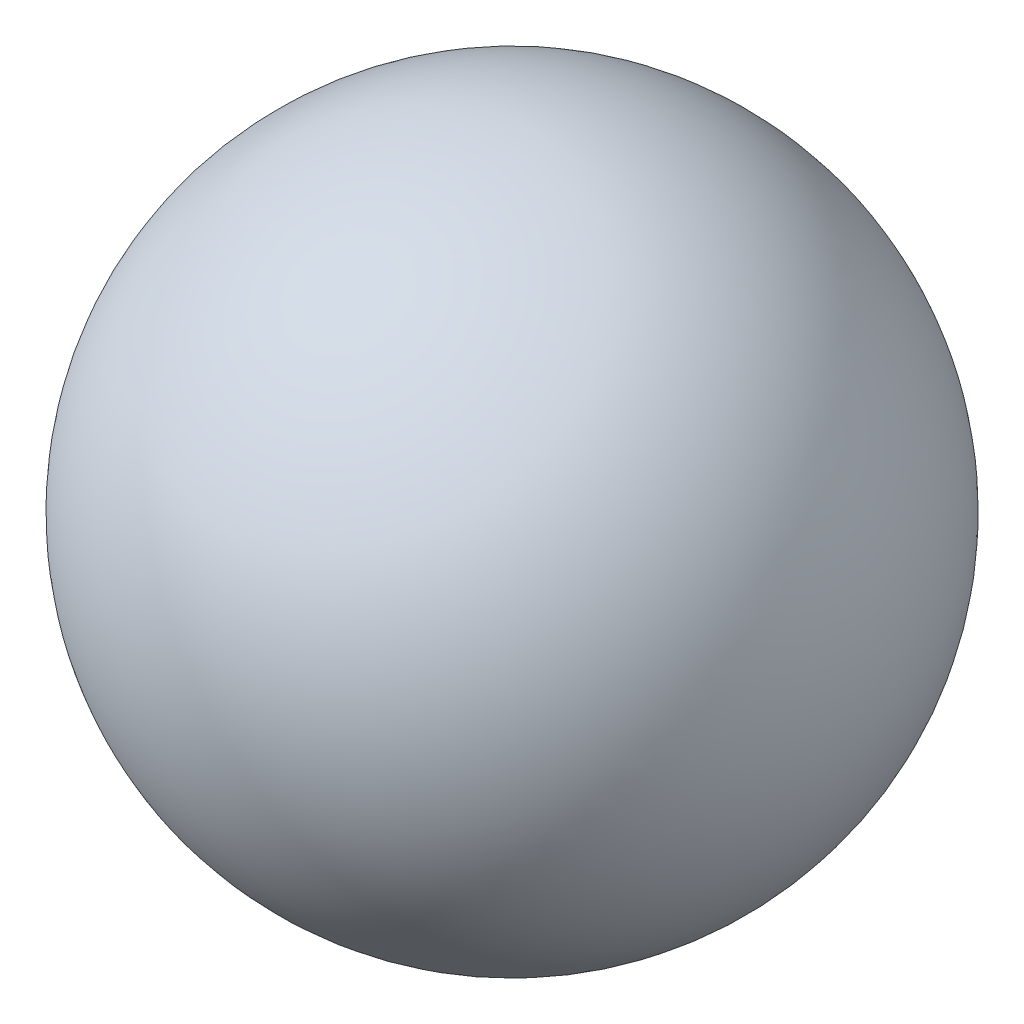
from build123d import *


with BuildPart() as part:
    # Sketch3 → Revolve4 (revolve)
    with BuildSketch(Plane(origin=(0, 0, 0), x_dir=(1, 0, 0), z_dir=(0, 1, 0))):
        with BuildLine():
            Line((0, -2.38125), (0, 2.38125))
            ThreePointArc((0, 2.38125), (2.38125, 0), (0, -2.38125))
        make_face()
    revolve(axis=Axis((0, 0, 2.38125), (0, 0, -1)))


solid = part.part
